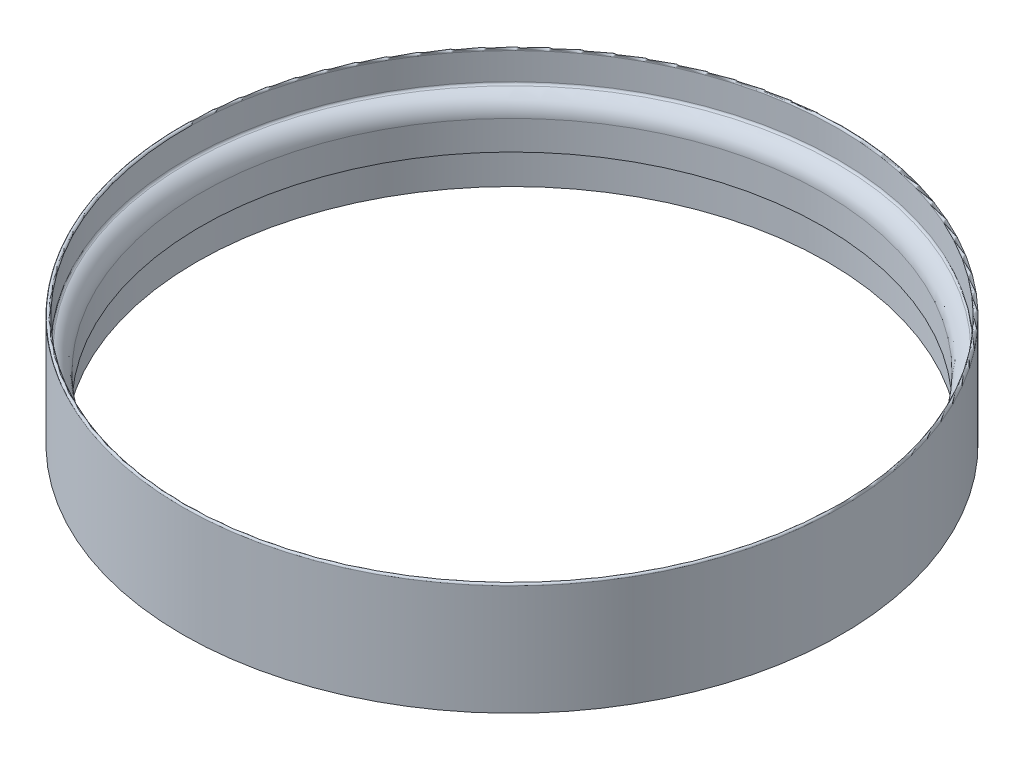
from build123d import *

# Parameters (mm, degrees)
FILLET1_R = 0.79375
FILLET2_R = 0.53975


with BuildPart() as part:
    # Sketch1 → Revolve1 (revolve)
    with BuildSketch(Plane(origin=(0, 0, 0), x_dir=(0, 0, -1), z_dir=(1, 0, 0)), mode=Mode.PRIVATE) as revolve1_sk:
        with BuildLine():
            Line((-104.902, 0), (-100.457, 0))
            Line((-100.457, 0), (-100.457, 10.5000044))
            Line((-100.457, 10.5000044), (-99.06, 10.5000044))
            Line((-99.06, 10.5000044), (-99.06, 19.7710044))
            ThreePointArc((-99.06, 19.7710044), (-100.389884214, 23.659569367), (-103.8225, 25.919365462))
            Line((-103.8225, 25.919365462), (-103.8225, 35.6460044))
            Line((-103.8225, 35.6460044), (-104.902, 35.6460044))
            Line((-104.902, 35.6460044), (-104.902, 0))
        make_face()
    revolve(revolve1_sk.sketch.rotate(Axis((0, 0, 0), (0, 1, 0)), 180), axis=Axis((0, 0, 0), (0, 1, 0)))

    # Fillet1
    fillet1_edges = [part.edges().sort_by_distance(p)[0] for p in [
        (0, 25.919365462, 103.8225),
        (0, 10.5000044, 100.457),
    ]]
    fillet(fillet1_edges, radius=FILLET1_R)

    # Fillet2
    fillet2_edges = [part.edges().sort_by_distance(p)[0] for p in [
        (0, 35.6460044, 104.902),
        (0, 35.6460044, 103.8225),
    ]]
    fillet(fillet2_edges, radius=FILLET2_R - 0.0001)  # a hair under: the kernel refuses the full size


solid = part.part
